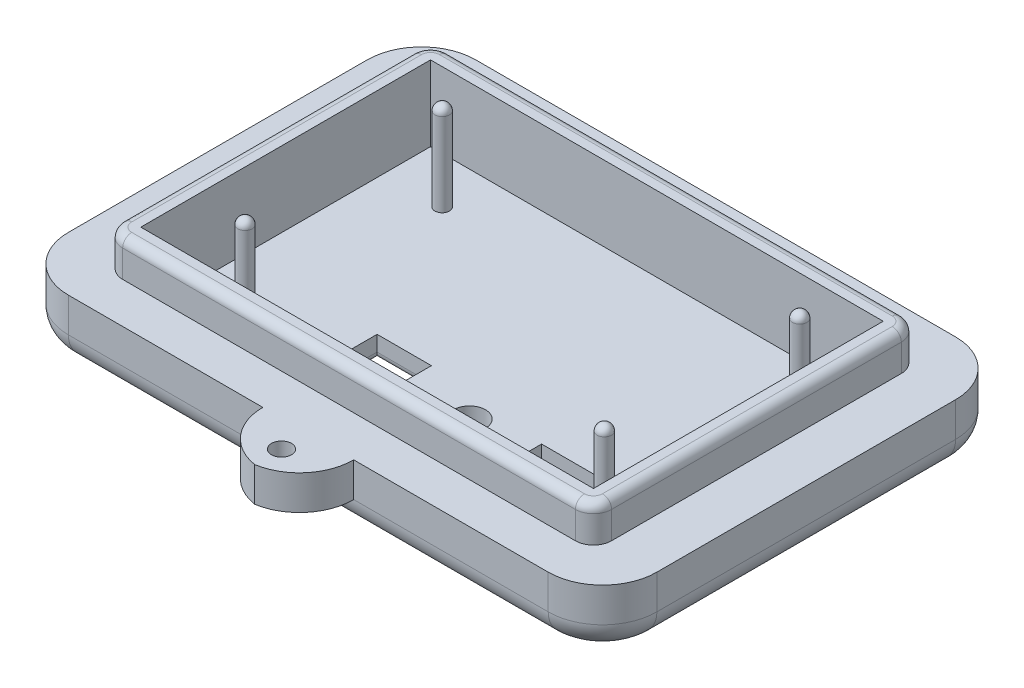
from build123d import *

# Parameters (mm, degrees)
SKETCH1_W                       = 82.55
SKETCH1_H                       = 57.15
BOSS_EXTRUDE1_DEPTH             = 8.636
FILLET2_R                       = 7.62
FILLET3_R                       = 3.81
SKETCH2_W                       = 63.5
SKETCH2_H                       = 40.64
CUT_EXTRUDE1_DEPTH              = 5.461
SKETCH7_W                       = 68.58
SKETCH7_H                       = 45.72
BOSS_EXTRUDE3_DEPTH             = 5.08
SKETCH8_W                       = 63.5
SKETCH8_H                       = 40.64
CUT_EXTRUDE3_DEPTH              = 5.08
SKETCH5_R                       = 1.016
BOSS_EXTRUDE4_DEPTH             = 12.7
SKETCH4_R                       = 2.25
SKETCH4_W                       = 12.6
SKETCH4_H                       = 5
SKETCH4_W_2                     = 7.62
SKETCH4_H_2                     = 7.62
CUT_EXTRUDE2_DEPTH              = 7.366
FILLET7_R                       = 1.016
FILLET8_R                       = 2.54
SKETCH9_W                       = 12.753817634
SKETCH9_H                       = 4.826
BOSS_EXTRUDE5_DEPTH             = 7.62
FILLET10_R                      = 7.62
FILLET11_R                      = 1.27
FILLET12_R                      = 1.016
F_4_40_TAPPED_HOLE2_D           = 2.794
F_4_40_TAPPED_HOLE2_DEPTH       = 7.62
F_4_40_TAPPED_HOLE2_CSINK_D     = 4.1148
F_4_40_TAPPED_HOLE2_CSINK_ANGLE = 100
F_4_40_TAPPED_HOLE2_TIP         = 0.839402285
FILLET13_R                      = 1.016


with BuildPart() as part:
    # Sketch1 → Boss-Extrude1 (new body)
    with BuildSketch(Plane(origin=(0, 0, 0), x_dir=(1, 0, 0), z_dir=(0, 1, 0))):
        with Locations((41.275, 28.575)):
            Rectangle(SKETCH1_W, SKETCH1_H)
    extrude(amount=BOSS_EXTRUDE1_DEPTH)

    # Fillet2
    fillet2_edges = [part.edges().sort_by_distance(p)[0] for p in [
        (0, 4.318, -57.15),
        (82.55, 4.318, -57.15),
        (82.55, 4.318, 0),
        (0, 4.318, 0),
    ]]
    fillet(fillet2_edges, radius=FILLET2_R)

    # Fillet3
    fillet3_edges = [part.edges().sort_by_distance(p)[0] for p in [
        (41.275, 0, -57.15),
        (0, 0, -28.575),
        (82.55, 0, -28.575),
        (41.275, 0, 0),
        (2.231846327, 0, -54.918153673),
        (2.231846327, 0, -2.231846327),
        (80.318153673, 0, -2.231846327),
        (80.318153673, 0, -54.918153673),
    ]]
    fillet(fillet3_edges, radius=FILLET3_R)

    # Sketch2 → Cut-Extrude1 (cut)
    with BuildSketch(Plane(origin=(0, 8.636, 0), x_dir=(1, 0, 0), z_dir=(0, 1, 0))):
        with Locations((41.275, 28.575)):
            Rectangle(SKETCH2_W, SKETCH2_H)
    extrude(amount=-CUT_EXTRUDE1_DEPTH, mode=Mode.SUBTRACT)

    # Sketch7 → Boss-Extrude3 (add)
    with BuildSketch(Plane(origin=(0, 8.636, 0), x_dir=(1, 0, 0), z_dir=(0, 1, 0))):
        with Locations((41.275, 28.575)):
            Rectangle(SKETCH7_W, SKETCH7_H)
    extrude(amount=BOSS_EXTRUDE3_DEPTH)

    # Sketch8 → Cut-Extrude3 (cut)
    with BuildSketch(Plane(origin=(0, 13.716, 0), x_dir=(1, 0, 0), z_dir=(0, 1, 0))):
        with Locations((41.275, 28.575)):
            Rectangle(SKETCH8_W, SKETCH8_H)
    extrude(amount=-CUT_EXTRUDE3_DEPTH, mode=Mode.SUBTRACT)

    # Sketch5 → Boss-Extrude4 (add)
    with BuildSketch(Plane(origin=(0, 3.175, 0), x_dir=(1, 0, 0), z_dir=(0, 1, 0))):
        with Locations(Location((17.665, 42.392, 0), (0, 0, 90))):
            Circle(SKETCH5_R)
        with Locations(Location((17.665, 14.732, 0), (0, 0, 90))):
            Circle(SKETCH5_R)
        with Locations(Location((67.945, 42.259, 0), (0, 0, 90))):
            Circle(SKETCH5_R)
        with Locations(Location((67.945, 14.859, 0), (0, 0, 90))):
            Circle(SKETCH5_R)
    extrude(amount=BOSS_EXTRUDE4_DEPTH)

    # Sketch4 → Cut-Extrude2 (cut)
    with BuildSketch(Plane(origin=(0, 3.175, 0), x_dir=(1, 0, 0), z_dir=(0, 1, 0))):
        with Locations(Location((45.339, 18.542, 0), (0, 0, 270))):
            Circle(SKETCH4_R)
        with Locations((59.74, 18.059)):
            Rectangle(SKETCH4_W, SKETCH4_H)
        with Locations((32.385, 18.542)):
            Rectangle(SKETCH4_W_2, SKETCH4_H_2)
    extrude(amount=-CUT_EXTRUDE2_DEPTH, mode=Mode.SUBTRACT)

    # Fillet7
    fillet7_edges = [part.edges().sort_by_distance(p)[0] for p in [
        (17.665, 15.875, -41.376),
        (17.665, 15.875, -13.716),
        (67.945, 15.875, -41.243),
    ]]
    fillet(fillet7_edges, radius=FILLET7_R)

    # Fillet8
    fillet8_edges = [part.edges().sort_by_distance(p)[0] for p in [
        (75.565, 11.176, -51.435),
        (6.985, 11.176, -51.435),
        (6.985, 11.176, -5.715),
        (75.565, 11.176, -5.715),
    ]]
    fillet(fillet8_edges, radius=FILLET8_R)

    # Sketch9 → Boss-Extrude5 (add)
    with BuildSketch(Plane.XY):
        with Locations((41.275, 6.223)):
            Rectangle(SKETCH9_W, SKETCH9_H)
    extrude(amount=BOSS_EXTRUDE5_DEPTH)

    # Fillet10
    # the kernel refuses this fillet: 7.62 mm, written as the material it takes off along each edge
    with BuildSketch(Plane(origin=(47.651908817, -15.24, 7.62), x_dir=(0, 0, -1), z_dir=(0, 1, 0)), Plane(origin=(34.898091183, 27.686, 7.62), x_dir=(0, 0, -1), z_dir=(0, -1, 0))) as fillet10_piece_1:
        with BuildLine():
            CenterArc((FILLET10_R, FILLET10_R), FILLET10_R, 180, 90)
            Line((0, FILLET10_R), (0, 0))
            Line((0, 0), (FILLET10_R, 0))
        make_face()
    extrude(amount=42.926, mode=Mode.SUBTRACT)

    # Fillet11
    fillet11_edges = [part.edges().sort_by_distance(p)[0] for p in [
        (41.275, 13.716, -51.435),
        (75.565, 13.716, -28.575),
        (6.985, 13.716, -28.575),
        (41.275, 13.716, -5.715),
        (7.728948776, 13.716, -50.691051224),
        (7.728948776, 13.716, -6.458948776),
        (74.821051224, 13.716, -6.458948776),
        (74.821051224, 13.716, -50.691051224),
    ]]
    fillet(fillet11_edges, radius=FILLET11_R)

    # Fillet12
    fillet12_edges = [part.edges().sort_by_distance(p)[0] for p in [
        (67.945, 15.875, -13.843),
    ]]
    fillet(fillet12_edges, radius=FILLET12_R)

    # #4-40 Tapped Hole2
    with Locations(Plane(origin=(0, 3.81, 0), x_dir=(-1, 0, 0), z_dir=(0, -1, 0))):
        with Locations((-41.275, -3.758960106)):
            CounterSinkHole(F_4_40_TAPPED_HOLE2_D / 2, F_4_40_TAPPED_HOLE2_CSINK_D / 2, depth=F_4_40_TAPPED_HOLE2_DEPTH, counter_sink_angle=F_4_40_TAPPED_HOLE2_CSINK_ANGLE)
            with Locations((0, 0, -(F_4_40_TAPPED_HOLE2_DEPTH + F_4_40_TAPPED_HOLE2_TIP / 2))):  # 118° drill point
                Cone(0, F_4_40_TAPPED_HOLE2_D / 2, F_4_40_TAPPED_HOLE2_TIP, mode=Mode.SUBTRACT)

    # Fillet13
    fillet13_edges = [part.edges().sort_by_distance(p)[0] for p in [
        (45.339, 0, -20.792),
        (32.385, 0, -14.732),
        (36.195, 0, -18.542),
        (32.385, 0, -22.352),
        (28.575, 0, -18.542),
        (59.74, 0, -15.559),
        (66.04, 0, -18.059),
        (59.74, 0, -20.559),
        (53.44, 0, -18.059),
    ]]
    fillet(fillet13_edges, radius=FILLET13_R)


solid = part.part
